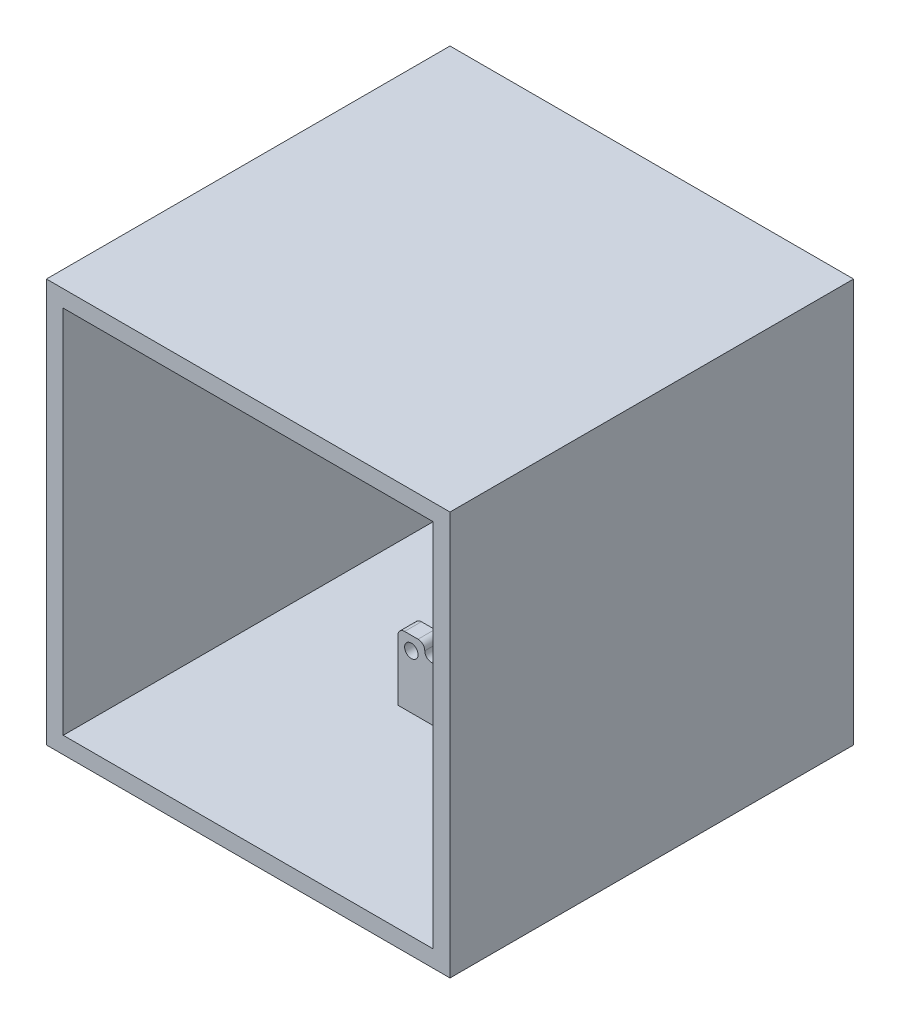
from build123d import *

# Parameters (mm, degrees)
BOSS_EXTRUDE1_DEPTH      = 38.1
BOSS_EXTRUDE1_DEPTH_BACK = 38.1
SKETCH1_W                = 76.2
SKETCH1_H                = 76.2
SHELL1_T                 = -3.175
SKETCH2_W                = 16.51
SKETCH2_H                = 3.175
BOSS_EXTRUDE2_DEPTH      = 12.7
SKETCH3_R                = 1.27
SKETCH3_W                = 6.35
SKETCH3_H                = 2.54
CUT_EXTRUDE1_DEPTH       = 12.7
FILLET1_R                = 1.27
FILLET1_OF_MIRROR2_R     = 1.27
CHAMFER1_SIZE            = 7.62


with BuildPart() as part:
    # Sketch1 → Boss-Extrude1 (new, two sides: drawn at the far end of the back side and taken through both)
    with BuildSketch(Plane.XY.offset(-BOSS_EXTRUDE1_DEPTH_BACK)):
        Rectangle(SKETCH1_W, SKETCH1_H)
    extrude(amount=BOSS_EXTRUDE1_DEPTH + BOSS_EXTRUDE1_DEPTH_BACK)

    # Shell1
    shell1_openings = [part.faces().sort_by_distance(p)[0] for p in [
        (0, 0, 38.1),
    ]]
    offset(amount=SHELL1_T, openings=shell1_openings, kind=Kind.INTERSECTION)

    # Sketch2 → Boss-Extrude2 (add)
    with BuildSketch(Plane.XZ.offset(-34.925)):
        Rectangle(SKETCH2_W, SKETCH2_H)
    boss_extrude2 = extrude(amount=BOSS_EXTRUDE2_DEPTH)

    # Sketch3 → Cut-Extrude1 (cut, symmetric)
    with BuildSketch(Plane.XY.offset(1.5875)):
        with Locations(Location((-5.715, 24.765, 0), (0, 0, 180))):
            Circle(SKETCH3_R)
        with Locations(Location((5.715, 24.765, 0), (0, 0, 180))):
            Circle(SKETCH3_R)
        with Locations((0, 23.495)):
            Rectangle(SKETCH3_W, SKETCH3_H)
    cut_extrude1 = extrude(amount=CUT_EXTRUDE1_DEPTH, both=True, mode=Mode.SUBTRACT)

    # Fillet1
    fillet1_edges = [part.edges().sort_by_distance(p)[0] for p in [
        (-3.175, 24.765, 0),
        (8.255, 22.225, 0),
        (3.175, 22.225, 0),
        (-3.175, 22.225, 0),
        (-8.255, 22.225, 0),
        (3.175, 24.765, 0),
    ]]
    fillet(fillet1_edges, radius=FILLET1_R - 0.0001)  # a hair under: the kernel refuses the full size

    # Mirror2: Boss-Extrude2, Cut-Extrude1 across plane
    add(boss_extrude2.mirror(Plane.ZX))
    add(cut_extrude1.mirror(Plane.ZX), mode=Mode.SUBTRACT)

    # Fillet1 of Mirror2
    fillet1_of_mirror2_edges = [part.edges().sort_by_distance(p)[0] for p in [
        (-3.175, -24.765, 0),
        (8.255, -22.225, 0),
        (3.175, -22.225, 0),
        (-3.175, -22.225, 0),
        (-8.255, -22.225, 0),
        (3.175, -24.765, 0),
    ]]
    fillet(fillet1_of_mirror2_edges, radius=FILLET1_OF_MIRROR2_R - 0.0001)  # a hair under: the kernel refuses the full size

    # Chamfer1
    chamfer1_edges = [part.edges().sort_by_distance(p)[0] for p in [
        (0, -34.925, -1.5875),
        (0, 34.925, -1.5875),
    ]]
    chamfer(chamfer1_edges, length=CHAMFER1_SIZE)


solid = part.part
